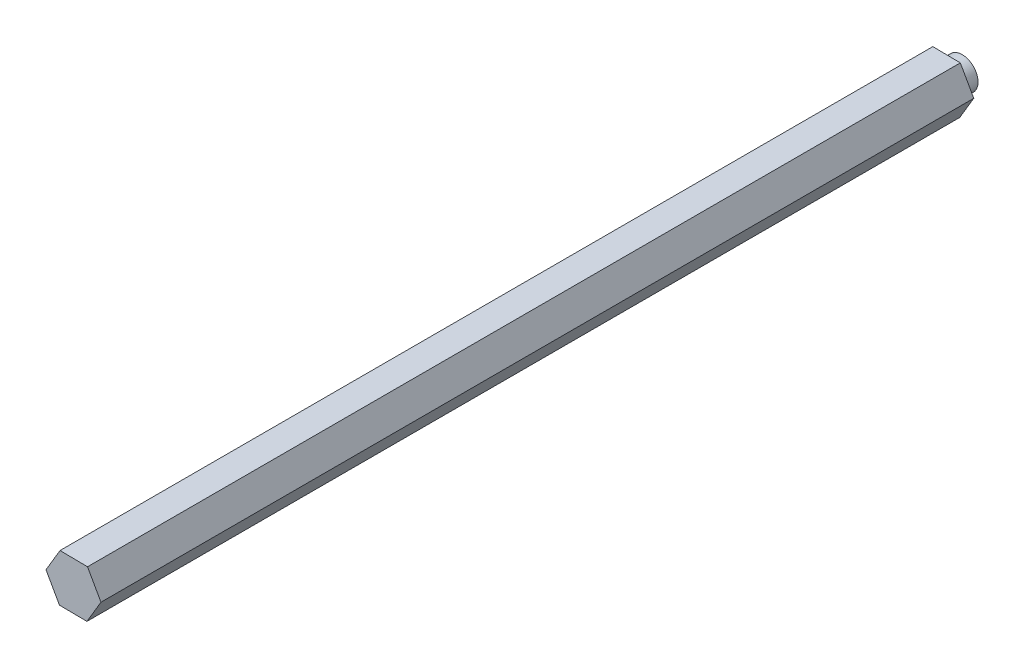
from build123d import *

# Parameters (mm, degrees)
BOSS_EXTRUDE1_DEPTH = 177.8
SKETCH3_R           = 3.175
CUT_EXTRUDE2_DEPTH  = 3.175


with BuildPart() as part:
    # Sketch1 → Boss-Extrude1 (new body)
    with BuildSketch(Plane.XY):
        Polygon((2.806881074, 4.728984419), (-2.691980104, 4.795322525), (-5.498861178, 0.066338106), (-2.806881074, -4.728984419), (2.691980104, -4.795322525), (5.498861178, -0.066338106), align=None)
    extrude(amount=BOSS_EXTRUDE1_DEPTH)

    # Sketch3 → Cut-Extrude2 (cut)
    with BuildSketch(Plane(origin=(0, 0, 0), x_dir=(-1, 0, 0), z_dir=(0, 0, -1))):
        Polygon((-2.806881074, 4.728984419), (-5.498861178, -0.066338106), (-2.691980104, -4.795322525), (2.806881074, -4.728984419), (5.498861178, 0.066338106), (2.691980104, 4.795322525), align=None)
        Circle(SKETCH3_R, mode=Mode.SUBTRACT)
    extrude(amount=-CUT_EXTRUDE2_DEPTH, mode=Mode.SUBTRACT)


solid = part.part
